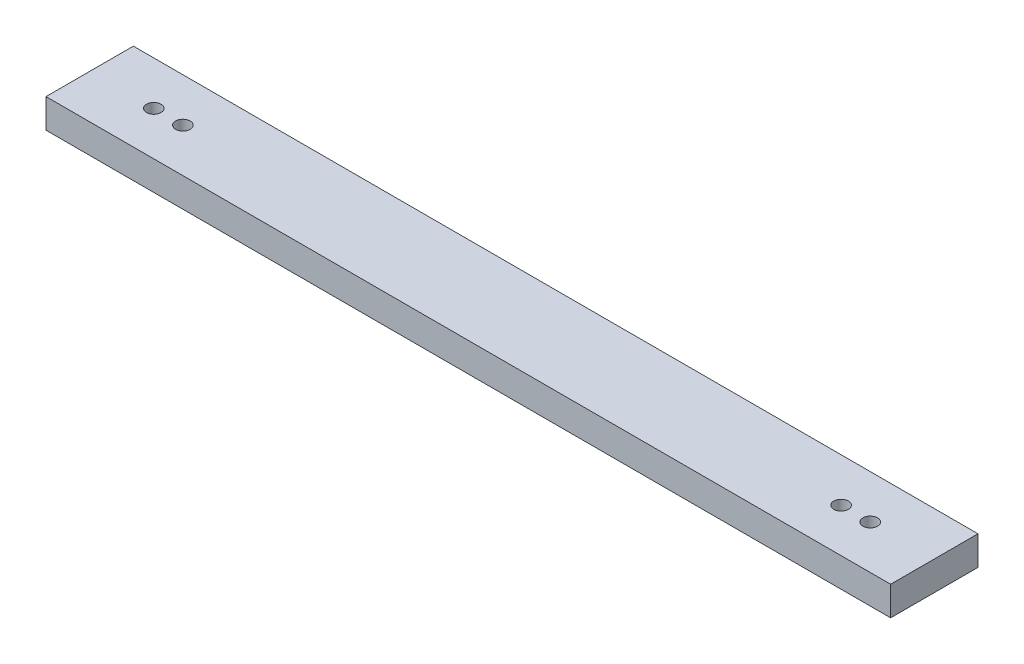
from build123d import *

# Parameters (mm, degrees)
SKETCH3_W           = 580
SKETCH3_H           = 60
BOSS_EXTRUDE1_DEPTH = 20
SKETCH4_R           = 5
CUT_EXTRUDE1_DEPTH  = 586.832740635


with BuildPart() as part:
    # Sketch3 → Boss-Extrude1 (new body)
    with BuildSketch(Plane(origin=(0, 0, 0), x_dir=(1, 0, 0), z_dir=(0, 1, 0))):
        with Locations((290, 50)):
            Rectangle(SKETCH3_W, SKETCH3_H)
    extrude(amount=BOSS_EXTRUDE1_DEPTH)

    # Sketch4 → Cut-Extrude1 (cut, through all)
    with BuildSketch(Plane(origin=(0, 20, 0), x_dir=(1, 0, 0), z_dir=(0, 1, 0))):
        with Locations((44, 50)):
            Circle(SKETCH4_R)
        with Locations((64, 50)):
            Circle(SKETCH4_R)
        with Locations((516, 50)):
            Circle(SKETCH4_R)
        with Locations((536, 50)):
            Circle(SKETCH4_R)
    extrude(amount=-CUT_EXTRUDE1_DEPTH, mode=Mode.SUBTRACT)


solid = part.part
